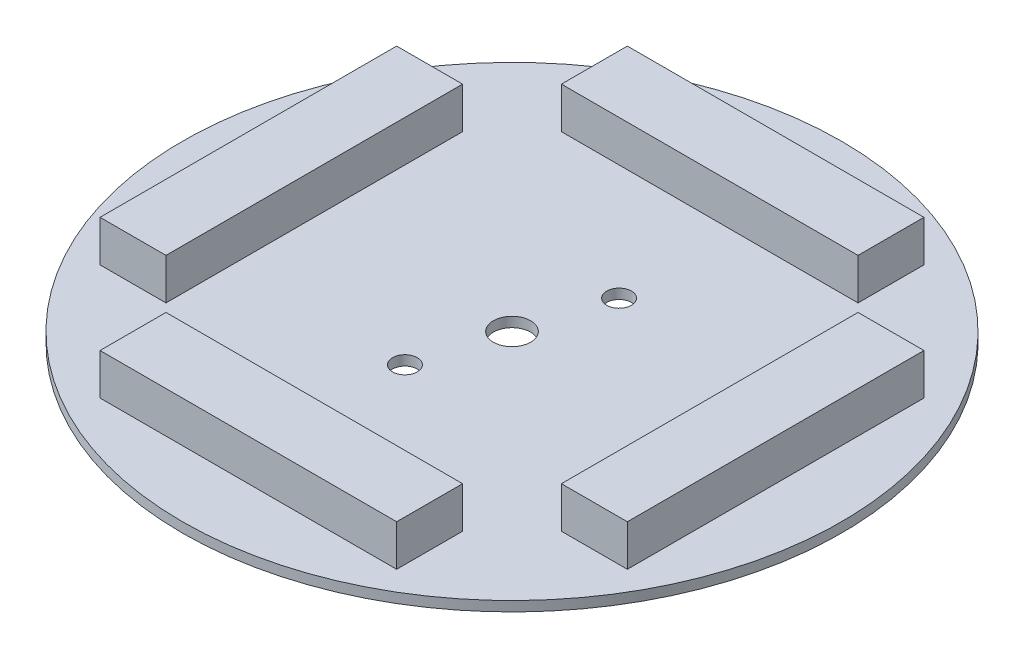
from build123d import *

# Parameters (mm, degrees)
SKETCH1_R                    = 20
SKETCH1_R_2                  = 1.1303
SKETCH1_R_3                  = 0.75
PCB_DEPTH                    = 0.6
SKETCH2_W                    = 18
SKETCH2_H                    = 4
HIROSE_CONNECTOR_STACK_DEPTH = 2.5
CIRPATTERN1_COUNT            = 4


with BuildPart() as part:
    # Sketch1 → PCB (new body)
    with BuildSketch(Plane(origin=(0, 0, 0), x_dir=(1, 0, 0), z_dir=(0, 1, 0))):
        Circle(SKETCH1_R)
        Circle(SKETCH1_R_2, mode=Mode.SUBTRACT)
        with Locations((1.5, 5)):
            Circle(SKETCH1_R_3, mode=Mode.SUBTRACT)
        with Locations((-1.5, -5)):
            Circle(SKETCH1_R_3, mode=Mode.SUBTRACT)
    extrude(amount=PCB_DEPTH)

    # Sketch2 → Hirose Connector Stack (add)
    with BuildSketch(Plane(origin=(0, 0.6, 0), x_dir=(1, 0, 0), z_dir=(0, 1, 0))):
        with Locations((0, 14)):
            Rectangle(SKETCH2_W, SKETCH2_H)
    hirose_connector_stack = extrude(amount=HIROSE_CONNECTOR_STACK_DEPTH)

    # CirPattern1: Hirose Connector Stack ×4 about axis
    cirpattern1_axis = Axis((0, 0.6, 0), (0, 1, 0))
    for i in range(1, CIRPATTERN1_COUNT):
        add(hirose_connector_stack.rotate(cirpattern1_axis, i * 360 / CIRPATTERN1_COUNT))


solid = part.part
